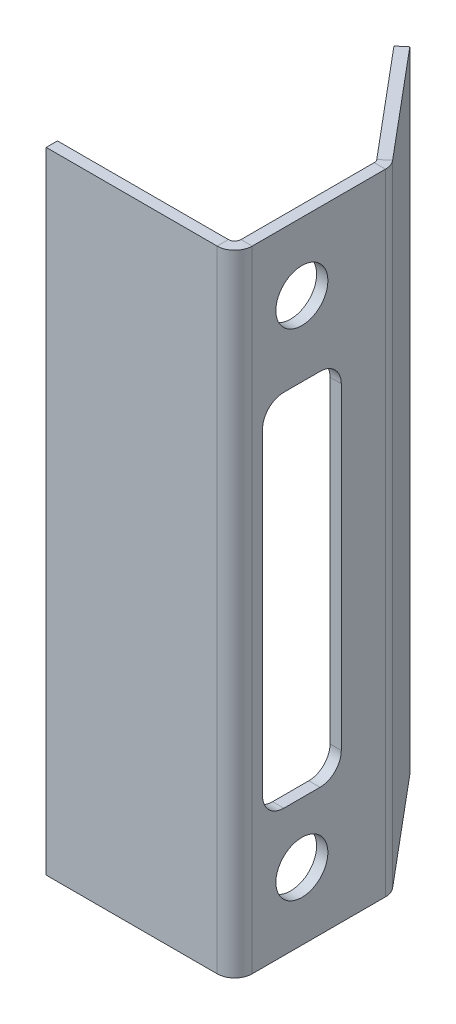
from build123d import *

# Parameters (mm, degrees)
BASE_FLANGE1_DEPTH = 88.9
CUT_EXTRUDE1_REACH = 101.653
SKETCH6_R          = 3.667750264
SKETCH6_W          = 11.0998
SKETCH6_H          = 50.8
FILLET2_R          = 3


# Sheet-metal steps are written as plain solids
with BuildPart() as part:
    # Sketch1 → Base-Flange1 (new body)
    with BuildSketch(Plane(origin=(0, 0, 0), x_dir=(1, 0, 0), z_dir=(0, 1, 0))):
        with BuildLine():
            Line((0, 0), (24.111, 0))
            ThreePointArc((24.111, 0), (24.739617928, 0.260382072), (25, 0.889))
            Line((25, 0.889), (25, 19.676430462))
            ThreePointArc((25, 19.676430462), (24.94638674, 19.980486369), (24.79201351, 20.247868647))
            Line((24.79201351, 20.247868647), (12.144247806, 35.320888862))
            Line((12.144247806, 35.320888862), (13.36034336, 36.341314193))
            Line((13.36034336, 36.341314193), (26.008109063, 21.268293977))
            ThreePointArc((26.008109063, 21.268293977), (26.438148775, 20.523443347), (26.5875, 19.676430462))
            Line((26.5875, 19.676430462), (26.5875, 0.889))
            ThreePointArc((26.5875, 0.889), (25.862149944, -0.862149944), (24.111, -1.5875))
            Line((24.111, -1.5875), (0, -1.5875))
            Line((0, -1.5875), (0, 0))
        make_face()
    extrude(amount=BASE_FLANGE1_DEPTH)

    # Sketch6 → Cut-Extrude1 (cut, up to next)
    with BuildSketch(Plane(origin=(26.5875, 0, 0), x_dir=(0, 0, -1), z_dir=(1, 0, 0)), mode=Mode.PRIVATE) as cut_extrude1_sk1:
        with Locations((7.889, 79.35)):
            Circle(SKETCH6_R)
    cut_extrude1_tool1 = extrude(cut_extrude1_sk1.sketch, amount=-CUT_EXTRUDE1_REACH, mode=Mode.PRIVATE) & part.part
    # Sketch6 → Cut-Extrude1 (cut, up to next)
    with BuildSketch(Plane(origin=(26.5875, 0, 0), x_dir=(0, 0, -1), z_dir=(1, 0, 0)), mode=Mode.PRIVATE) as cut_extrude1_sk2:
        with Locations((7.889, 9.5)):
            Circle(SKETCH6_R)
    cut_extrude1_tool2 = extrude(cut_extrude1_sk2.sketch, amount=-CUT_EXTRUDE1_REACH, mode=Mode.PRIVATE) & part.part
    # Sketch6 → Cut-Extrude1 (cut, up to next)
    with BuildSketch(Plane(origin=(26.5875, 0, 0), x_dir=(0, 0, -1), z_dir=(1, 0, 0)), mode=Mode.PRIVATE) as cut_extrude1_sk3:
        with Locations((7.897214616, 43.4059352)):
            Rectangle(SKETCH6_W, SKETCH6_H)
    cut_extrude1_tool3 = extrude(cut_extrude1_sk3.sketch, amount=-CUT_EXTRUDE1_REACH, mode=Mode.PRIVATE) & part.part
    add(cut_extrude1_tool1.solids().sort_by_distance((26.5875, 79.35, -7.889))[0], mode=Mode.SUBTRACT)
    add(cut_extrude1_tool2.solids().sort_by_distance((26.5875, 9.5, -7.889))[0], mode=Mode.SUBTRACT)
    add(cut_extrude1_tool3.solids().sort_by_distance((26.5875, 43.405935, -7.897215))[0], mode=Mode.SUBTRACT)

    # Fillet2
    fillet2_edges = [part.edges().sort_by_distance(p)[0] for p in [
        (25.79375, 68.8059352, -13.447114616),
        (25.79375, 18.0059352, -13.447114616),
        (25.79375, 18.0059352, -2.347314616),
        (25.79375, 68.8059352, -2.347314616),
    ]]
    fillet(fillet2_edges, radius=FILLET2_R)


solid = part.part
